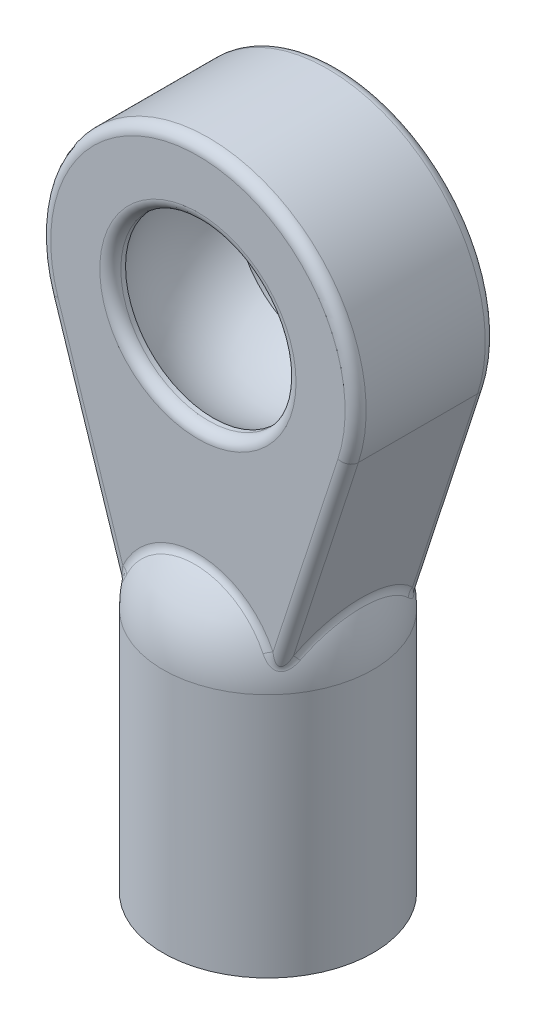
from build123d import *

# Parameters (mm, degrees)
BOSS_EXTRU_1_DEPTH      = 2
BOSS_EXTRU_1_DEPTH_BACK = 2
ESQUISSE2_R             = 2.5
CONG_1_R                = 0.3


with BuildPart() as part:
    # Esquisse1 → Révolution1 (revolve)
    with BuildSketch(Plane.XY):
        with BuildLine():
            Line((0, 6), (0, 10))
            ThreePointArc((0, 10), (-2.121320344, 9.121320344), (-3, 7))
            Line((-3, 7), (-3, 0))
            Line((-3, 0), (-1.5, 0))
            Line((-1.5, 0), (-1.5, 6))
            Line((-1.5, 6), (0, 6))
        make_face()
    revolve(axis=Axis((0, -0.674983233, 0), (0, 1, 0)))

    # Esquisse2 → Boss.-Extru.1 (add, two sides: drawn at the far end of the back side and taken through both)
    with BuildSketch(Plane.XY.offset(-BOSS_EXTRU_1_DEPTH_BACK)):
        with BuildLine():
            Line((-2.132222439, 7), (-4.279754323, 13.609423525))
            ThreePointArc((-4.279754323, 13.609423525), (0, 19.5), (4.279754323, 13.609423525))
            Line((4.279754323, 13.609423525), (2.132222439, 7))
            Line((2.132222439, 7), (-2.132222439, 7))
        make_face()
        with Locations((0, 15)):
            Circle(ESQUISSE2_R, mode=Mode.SUBTRACT)
    extrude(amount=BOSS_EXTRU_1_DEPTH + BOSS_EXTRU_1_DEPTH_BACK)

    # Esquisse3 → Enlèvement de matière-Révolution1 (revolve, cut)
    with BuildSketch(Plane.XY):
        with BuildLine():
            Line((0, 17.95), (0, 12.05))
            ThreePointArc((0, 12.05), (-2.95, 15), (0, 17.95))
        make_face()
    revolve(axis=Axis((0, 11.065209796, 0), (0, 1, 0)), mode=Mode.SUBTRACT)

    # Congé1
    cong_1_edges = [part.edges().sort_by_distance(p)[0] for p in [
        (0, 19.5, -2),
        (-3.249763904, 10.439438968, -2),
        (3.249763904, 10.439438968, -2),
        (-2.5, 15, -2),
        (-2.5, 15, 2),
        (-3.249763904, 10.439438968, 2),
        (0, 19.5, 2),
        (3.249763904, 10.439438968, 2),
    ]]
    fillet(cong_1_edges, radius=CONG_1_R)
    cong_1_2_edges = [part.edges().sort_by_distance(p)[0] for p in [
        (-2.547134089, 8.276966755, -0.938863057),
        (2.611797225, 8.475979423, 3.5e-08),
        (2.4e-08, 9.236067977, -2),
        (2.4e-08, 9.236067977, 2),
        (-2.547134089, 8.276966755, 0.938863057),
        (-2.233315922, 7.596093395, 1.912321273),
        (2.233315922, 7.596093395, 1.912321273),
        (-2.233299855, 7.596099057, -1.912338273),
        (2.233299855, 7.596099057, -1.912338273),
    ]]
    fillet(cong_1_2_edges, radius=CONG_1_R)


solid = part.part
